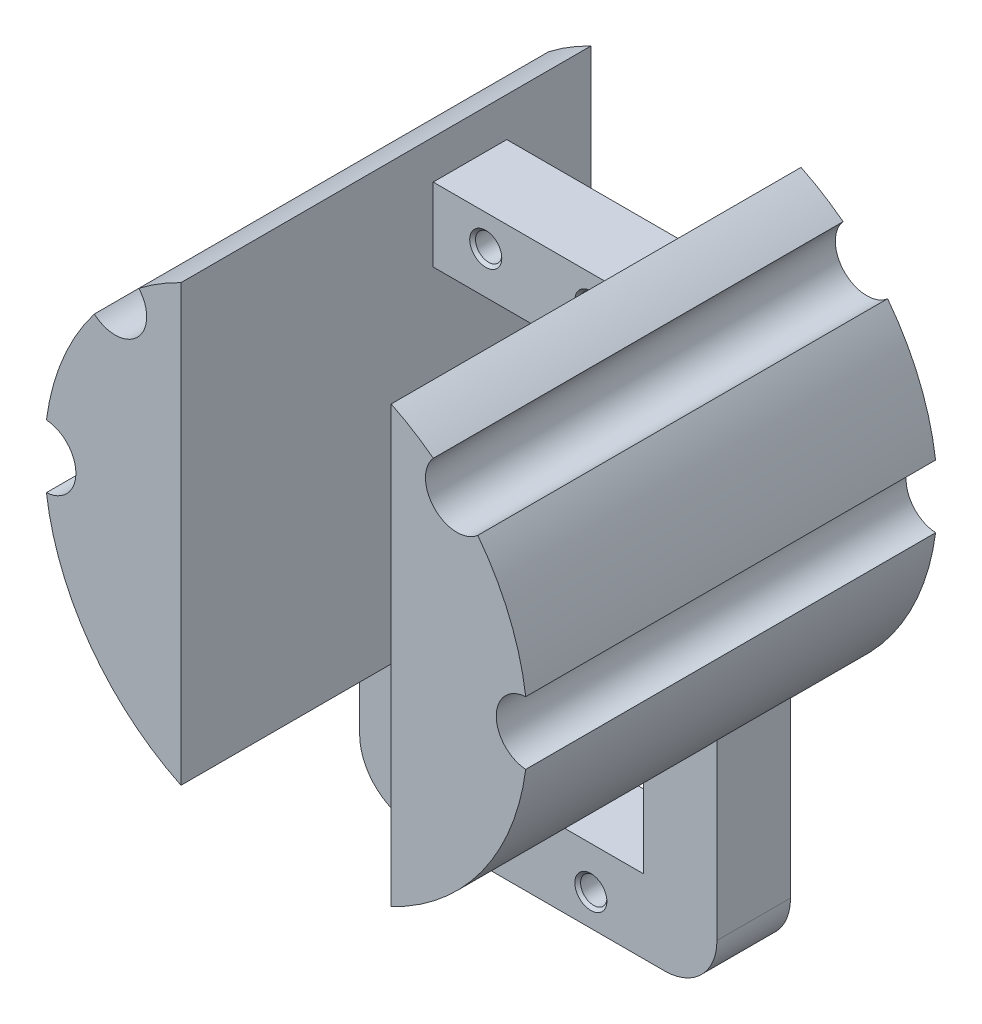
from build123d import *

# Parameters (mm, degrees)
SKETCH_1_W                  = 34
SKETCH_1_H                  = 54
SKETCH_1_W_2                = 20
SKETCH_1_H_2                = 40
EXTRUDE_1_DEPTH             = 7
EXTRUDE_2_DEPTH             = 31
EXTRUDE_2_DEPTH_BACK        = 8
SKETCH_3_R                  = 3
CUT_EXTRUDE_1_DEPTH         = 59.472215624
FILLET_1_R                  = 5
M3X0_51_D                   = 2.5
M3X0_51_CSINK_D             = 3.05
M3X0_51_CSINK_ANGLE         = 90
PATTERN_LINEAR_1_COUNT      = 2
PATTERN_LINEAR_1_PITCH      = 10
PATTERN_LINEAR_1_COUNT_DIR2 = 2
PATTERN_LINEAR_1_PITCH_DIR2 = 48


with BuildPart() as part:
    # Эскиз1 → Бобышка-Вытянуть1 (new body)
    with BuildSketch(Plane.XY):
        with Locations((0, -10)):
            Rectangle(SKETCH_1_W, SKETCH_1_H)
        with Locations((0, -10)):
            Rectangle(SKETCH_1_W_2, SKETCH_1_H_2, mode=Mode.SUBTRACT)
    extrude(amount=EXTRUDE_1_DEPTH)

    # Эскиз2 → Бобышка-Вытянуть2 (add, two sides: drawn at the far end of the back side and taken through both)
    with BuildSketch(Plane.XY.offset(-EXTRUDE_2_DEPTH_BACK)):
        with BuildLine():
            Line((10, -20.712315177), (10, 20.712315177))
            ThreePointArc((10, 20.712315177), (23, 0), (10, -20.712315177))
        make_face()
        with BuildLine():
            Line((-10, -20.712315177), (-10, 20.712315177))
            ThreePointArc((-10, 20.712315177), (-23, 0), (-10, -20.712315177))
        make_face()
    extrude(amount=EXTRUDE_2_DEPTH + EXTRUDE_2_DEPTH_BACK)

    # Эскиз3 → Вырез-Вытянуть1 (cut, through all)
    with BuildSketch(Plane.XY.offset(31)):
        with Locations((-23, 0)):
            Circle(SKETCH_3_R)
        with Locations((-16.263455967, 16.263455967)):
            Circle(SKETCH_3_R)
        with Locations((16.263455967, 16.263455967)):
            Circle(SKETCH_3_R)
        with Locations((23, 0)):
            Circle(SKETCH_3_R)
    extrude(amount=-CUT_EXTRUDE_1_DEPTH, mode=Mode.SUBTRACT)

    # Скругление1
    fillet_1_edges = [part.edges().sort_by_distance(p)[0] for p in [
        (-17, -37, 3.5),
        (17, -37, 3.5),
    ]]
    fillet(fillet_1_edges, radius=FILLET_1_R)

    # Отверстие обработанное метчиком M3x0.51 (through all)
    with Locations(Plane.XY.offset(7)):
        with Locations((-5, 14)):
            m3x0_51 = CounterSinkHole(M3X0_51_D / 2, M3X0_51_CSINK_D / 2, counter_sink_angle=M3X0_51_CSINK_ANGLE)

    # Линейный массив1: M3x0.51 2 × 2
    with Locations(*[(i * PATTERN_LINEAR_1_PITCH, -j * PATTERN_LINEAR_1_PITCH_DIR2, 0) for i in range(PATTERN_LINEAR_1_COUNT) for j in range(PATTERN_LINEAR_1_COUNT_DIR2) if (i, j) != (0, 0)]):
        add(m3x0_51, mode=Mode.SUBTRACT)


solid = part.part
